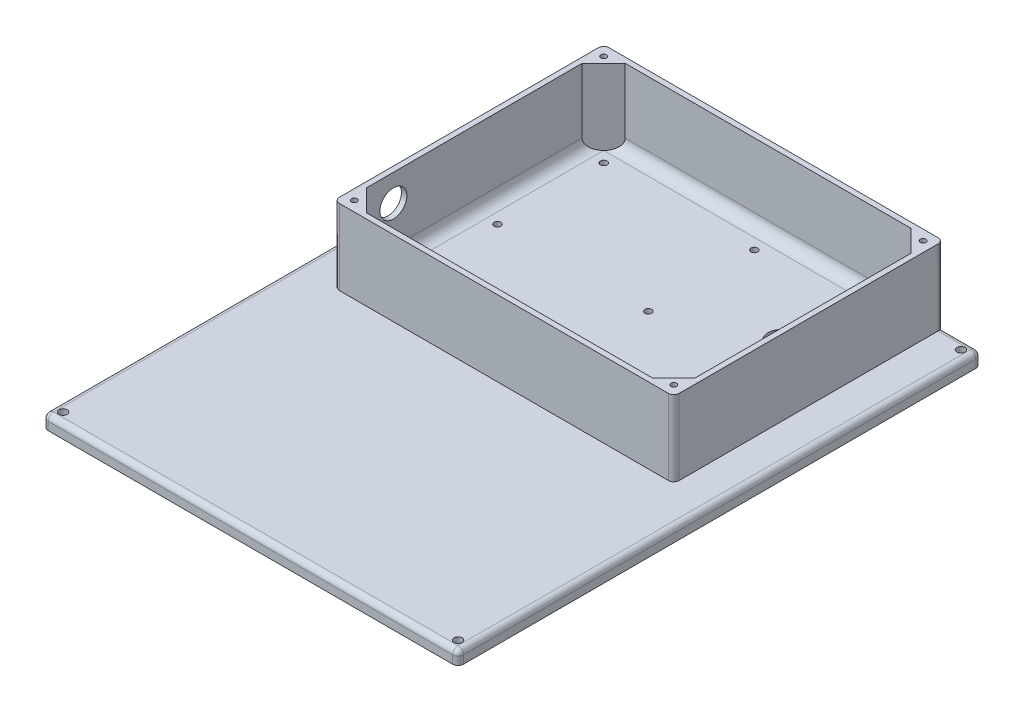
from build123d import *

# Parameters (mm, degrees)
SKETCH2_W                      = 195.58
SKETCH2_H                      = 246.38
BOSS_EXTRUDE1_DEPTH            = 6.35
FILLET1_R                      = 2.54
SHELL1_START                   = -95.25
SHELL1_OUTLINE_W               = 3.81
SHELL1_OUTLINE_H               = 241.3
SHELL1_DEPTH                   = 190.5
SKETCH3_W                      = 160.02
SKETCH3_H                      = 127
BOSS_EXTRUDE2_DEPTH            = 38.1
FILLET2_R                      = 2.54
SHELL2_START                   = 6.35
SHELL2_OUTLINE_W               = 154.94
SHELL2_OUTLINE_H               = 121.92
SHELL2_DEPTH                   = 35.56
FILLET3_R                      = 5.08
ARDUINO_MOUNT_HOLES_D          = 3.2
CHAMFER1_START                 = 5
CHAMFER1_DEPTH                 = 36.91
TOP_COVER_HOLES_D              = 2.64668
TOP_COVER_HOLES_DEPTH          = 12.7
TOP_COVER_HOLES_TIP            = 0.795142892
CHAMFER2_SIZE                  = 10.16
BOTTOM_COVER_HOLES_D           = 3.81
BOTTOM_COVER_HOLES_DEPTH       = 6.35
BOTTOM_COVER_HOLES_TIP         = 1.144639479
HOLE_FOR_WIRING_D              = 12.7
F_1_2_0_5000_DOWEL_HOLE2_D     = 12.7
F_1_2_0_5000_DOWEL_HOLE2_DEPTH = 2.54
F_1_2_0_5000_DOWEL_HOLE2_TIP   = 3.815464931


with BuildPart() as part:
    # Sketch2 → Boss-Extrude1 (new body)
    with BuildSketch(Plane(origin=(0, 0, 0), x_dir=(1, 0, 0), z_dir=(0, 1, 0))):
        Rectangle(SKETCH2_W, SKETCH2_H)
    extrude(amount=BOSS_EXTRUDE1_DEPTH)

    # Fillet1
    fillet1_edges = [part.edges().sort_by_distance(p)[0] for p in [
        (97.79, 6.35, 0),
        (0, 6.35, -123.19),
        (-97.79, 6.35, 0),
        (-97.79, 3.175, -123.19),
        (97.79, 3.175, -123.19),
        (97.79, 3.175, 123.19),
        (-97.79, 3.175, 123.19),
        (0, 6.35, 123.19),
    ]]
    fillet(fillet1_edges, radius=FILLET1_R)

    # Shell1: read off the stored shape, not the designer's step
    # Shell1 outline → Shell1 (cut)
    with BuildSketch(Plane.YZ.offset(SHELL1_START)):
        with Locations((1.905, 0)):
            Rectangle(SHELL1_OUTLINE_W, SHELL1_OUTLINE_H)
    extrude(amount=SHELL1_DEPTH, mode=Mode.SUBTRACT)

    # Sketch3 → Boss-Extrude2 (add)
    with BuildSketch(Plane(origin=(0, 3.81, 0), x_dir=(-1, 0, 0), z_dir=(0, -1, 0))):
        with Locations((0, 59.69)):
            Rectangle(SKETCH3_W, SKETCH3_H)
    extrude(amount=-BOSS_EXTRUDE2_DEPTH)

    # Fillet2
    fillet2_edges = [part.edges().sort_by_distance(p)[0] for p in [
        (80.01, 22.86, -123.19),
        (-80.01, 22.86, -123.19),
        (80.01, 24.13, 3.81),
        (-80.01, 24.13, 3.81),
    ]]
    fillet(fillet2_edges, radius=FILLET2_R)

    # Shell2: read off the stored shape, not the designer's step
    # Shell2 outline → Shell2 (cut)
    with BuildSketch(Plane(origin=(0, 0, 0), x_dir=(1, 0, 0), z_dir=(0, 1, 0)).offset(SHELL2_START)):
        with Locations((0, 59.69)):
            Rectangle(SHELL2_OUTLINE_W, SHELL2_OUTLINE_H)
    extrude(amount=SHELL2_DEPTH, mode=Mode.SUBTRACT)

    # Fillet3
    fillet3_edges = [part.edges().sort_by_distance(p)[0] for p in [
        (0, 6.35, -120.65),
        (77.47, 6.35, -59.69),
        (-77.47, 6.35, -59.69),
        (0, 6.35, 1.27),
    ]]
    fillet(fillet3_edges, radius=FILLET3_R)

    # Arduino Mount holes (through all)
    with Locations(Plane(origin=(0, 6.35, 0), x_dir=(1, 0, 0), z_dir=(0, 1, 0))):
        with Locations((3.690112, 110.49), (3.690112, 60.4901), (-67.31, 60.4901), (-67.31, 110.49)):
            Hole(ARDUINO_MOUNT_HOLES_D / 2)

    # Chamfer1: read off the stored shape, not the designer's step
    # Chamfer1 outline → Chamfer1 (add)
    with BuildSketch(Plane(origin=(0, 0, 0), x_dir=(1, 0, 0), z_dir=(0, 1, 0)).offset(CHAMFER1_START)):
        Polygon((-77.47, 110.49), (-67.31, 120.65), (-77.47, 120.65), align=None)
        Polygon((77.47, 120.65), (67.31, 120.65), (77.47, 110.49), align=None)
        Polygon((-67.31, -1.27), (-77.47, 8.89), (-77.47, -1.27), align=None)
        Polygon((77.47, -1.27), (77.47, 8.89), (67.31, -1.27), align=None)
    extrude(amount=CHAMFER1_DEPTH)

    # Top cover holes
    with Locations(Plane(origin=(0, 41.91, 0), x_dir=(1, 0, 0), z_dir=(0, 1, 0))):
        with Locations((75.2475, 0.9525), (-75.2475, 0.9525), (-75.2475, 118.4275), (75.2475, 118.4275)):
            Hole(TOP_COVER_HOLES_D / 2, depth=TOP_COVER_HOLES_DEPTH)
            with Locations((0, 0, -(TOP_COVER_HOLES_DEPTH + TOP_COVER_HOLES_TIP / 2))):  # 118° drill point
                Cone(0, TOP_COVER_HOLES_D / 2, TOP_COVER_HOLES_TIP, mode=Mode.SUBTRACT)

    # Chamfer2
    chamfer2_edges = [part.edges().sort_by_distance(p)[0] for p in [
        (-95.25, 1.905, -120.65),
        (-95.25, 1.905, 120.65),
        (95.25, 1.905, 120.65),
        (95.25, 1.905, -120.65),
    ]]
    chamfer(chamfer2_edges, length=CHAMFER2_SIZE)

    # Bottom cover holes
    with Locations(Plane(origin=(0, 0, 0), x_dir=(-1, 0, 0), z_dir=(0, -1, 0))):
        with Locations((-93.0275, 118.4275), (93.0275, 118.4275), (93.0275, -118.4275), (-93.0275, -118.4275)):
            Hole(BOTTOM_COVER_HOLES_D / 2, depth=BOTTOM_COVER_HOLES_DEPTH)
            with Locations((0, 0, -(BOTTOM_COVER_HOLES_DEPTH + BOTTOM_COVER_HOLES_TIP / 2))):  # 118° drill point
                Cone(0, BOTTOM_COVER_HOLES_D / 2, BOTTOM_COVER_HOLES_TIP, mode=Mode.SUBTRACT)

    # Hole for Wiring (through all)
    with Locations(Plane(origin=(0, 6.35, 0), x_dir=(1, 0, 0), z_dir=(0, 1, 0))):
        with Locations((46.99, 80.01)):
            Hole(HOLE_FOR_WIRING_D / 2)

    # 1/2 (0.5000) Dowel Hole2
    with Locations(Plane.ZY.offset(80.01)):
        with Locations((-21.59, 29.21)):
            Hole(F_1_2_0_5000_DOWEL_HOLE2_D / 2, depth=F_1_2_0_5000_DOWEL_HOLE2_DEPTH)
            with Locations((0, 0, -(F_1_2_0_5000_DOWEL_HOLE2_DEPTH + F_1_2_0_5000_DOWEL_HOLE2_TIP / 2))):  # 118° drill point
                Cone(0, F_1_2_0_5000_DOWEL_HOLE2_D / 2, F_1_2_0_5000_DOWEL_HOLE2_TIP, mode=Mode.SUBTRACT)


solid = part.part
